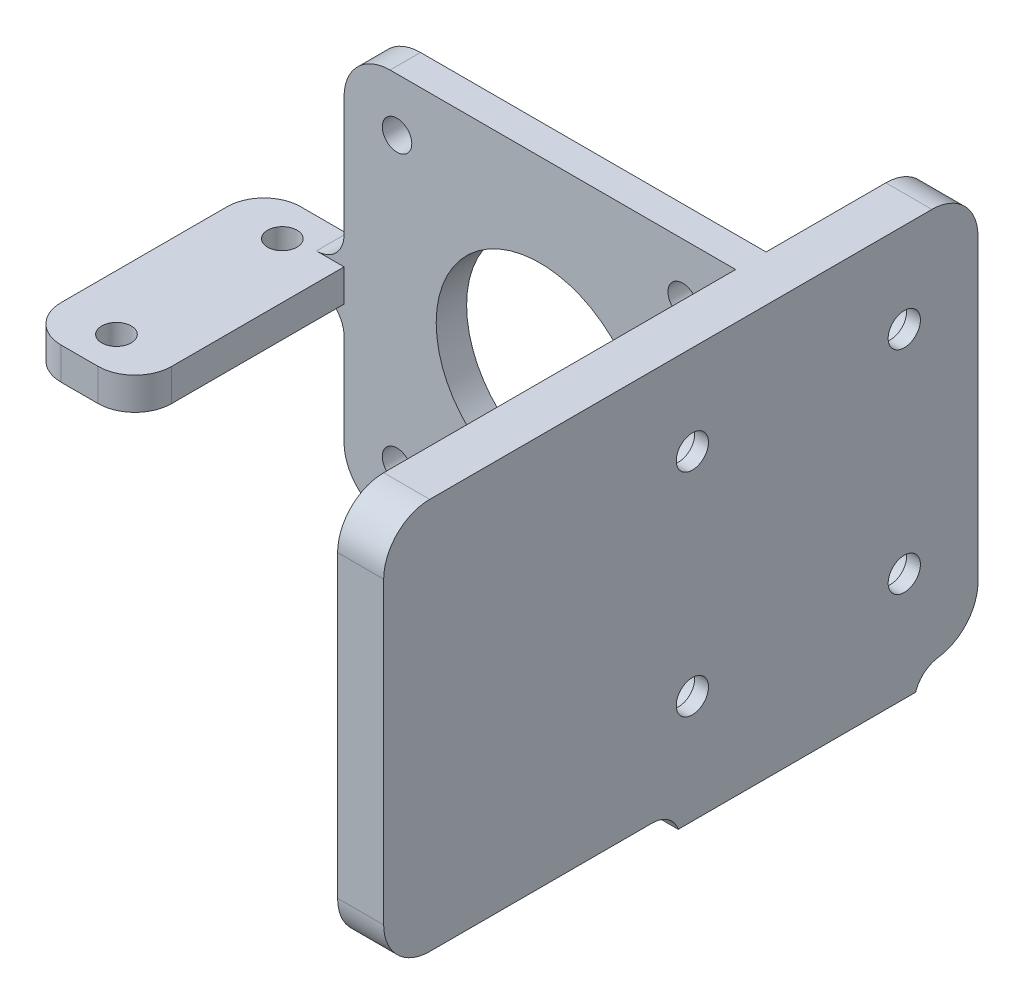
from build123d import *

# Parameters (mm, degrees)
CROQUIS1_W               = 42.5
CROQUIS1_H               = 42.5
SALIENTE_EXTRUIR1_DEPTH  = 5
CROQUIS6_W               = 5
CROQUIS6_H               = 42.5
SALIENTE_EXTRUIR2_DEPTH  = 4
CROQUIS7_W               = 4
CROQUIS7_H               = 42.5
SALIENTE_EXTRUIR3_DEPTH  = 42.5
CROQUIS8_R               = 11.25
CROQUIS8_R_2             = 1.6
CORTAR_EXTRUIR2_DEPTH    = 4
CROQUIS10_W              = 4
CROQUIS10_H              = 3.5
SALIENTE_EXTRUIR4_DEPTH  = 12
CROQUIS11_W              = 12
CROQUIS11_H              = 3.5
SALIENTE_EXTRUIR5_DEPTH  = 22
CROQUIS12_R              = 1.6
CORTAR_EXTRUIR4_DEPTH    = 3.5
REDONDEO1_R              = 5
REDONDEO2_R              = 5
REDONDEO3_R              = 4
CORTAR_EXTRUIR5_DEPTH    = 0.7
CROQUIS14_W              = 5
CROQUIS14_H              = 42.5
SALIENTE_EXTRUIR6_DEPTH  = 18
CROQUIS15_R              = 1.75
CORTAR_EXTRUIR6_DEPTH    = 5
CROQUIS16_R              = 2.8
CORTAR_EXTRUIR7_DEPTH    = 3.5
CROQUIS17_R              = 2.8
CORTAR_EXTRUIR8_DEPTH    = 3.5
REDONDEO5_R              = 5
CROQUIS18_R              = 1.6
SALIENTE_EXTRUIR8_DEPTH  = 2
CROQUIS19_R              = 1.6
CORTAR_EXTRUIR9_DEPTH    = 2
REDONDEO7_R              = 3
REDONDEO8_R              = 3
SALIENTE_EXTRUIR9_DEPTH  = 2
SALIENTE_EXTRUIR10_DEPTH = 2
CROQUIS22_W              = 26.97020456
CROQUIS22_H              = 2
CORTAR_EXTRUIR10_DEPTH   = 5
CROQUIS23_W              = 1.770204561
CROQUIS23_H              = 2
CORTAR_EXTRUIR11_DEPTH   = 5
REDONDEO9_R              = 3


with BuildPart() as part:
    # Croquis1 → Saliente-Extruir1 (new body)
    with BuildSketch(Plane(origin=(0, 0, 0), x_dir=(0, 0, -1), z_dir=(1, 0, 0))):
        with Locations((-2.329734219, -7.130398671)):
            Rectangle(CROQUIS1_W, CROQUIS1_H)
    extrude(amount=-SALIENTE_EXTRUIR1_DEPTH)

    # Croquis6 → Saliente-Extruir2 (add)
    with BuildSketch(Plane(origin=(0, 0, -18.920265781), x_dir=(-1, 0, 0), z_dir=(0, 0, -1))):
        with Locations((2.5, -7.130398671)):
            Rectangle(CROQUIS6_W, CROQUIS6_H)
    extrude(amount=SALIENTE_EXTRUIR2_DEPTH)

    # Croquis7 → Saliente-Extruir3 (add)
    with BuildSketch(Plane.ZY.offset(5)):
        with Locations((-20.920265781, -7.130398671)):
            Rectangle(CROQUIS7_W, CROQUIS7_H)
    extrude(amount=SALIENTE_EXTRUIR3_DEPTH)

    # Croquis8 → Cortar-Extruir2 (cut)
    with BuildSketch(Plane.XY.offset(-18.920265781)):
        with Locations((-26.25, -7.130398671)):
            Circle(CROQUIS8_R)
        with Locations((-41.75, 8.369601329)):
            Circle(CROQUIS8_R_2)
        with Locations((-10.75, 8.369601329)):
            Circle(CROQUIS8_R_2)
        with Locations((-10.75, -22.630398671)):
            Circle(CROQUIS8_R_2)
        with Locations((-41.75, -22.630398671)):
            Circle(CROQUIS8_R_2)
    extrude(amount=-CORTAR_EXTRUIR2_DEPTH, mode=Mode.SUBTRACT)

    # Croquis10 → Saliente-Extruir4 (add)
    with BuildSketch(Plane.ZY.offset(47.5)):
        with Locations((-20.920265781, -6.630398671)):
            Rectangle(CROQUIS10_W, CROQUIS10_H)
    extrude(amount=SALIENTE_EXTRUIR4_DEPTH)

    # Croquis11 → Saliente-Extruir5 (add)
    with BuildSketch(Plane.XY.offset(-18.920265781)):
        with Locations((-53.5, -6.630398671)):
            Rectangle(CROQUIS11_W, CROQUIS11_H)
    extrude(amount=SALIENTE_EXTRUIR5_DEPTH)

    # Croquis12 → Cortar-Extruir4 (cut)
    with BuildSketch(Plane(origin=(0, -4.880398671, 0), x_dir=(1, 0, 0), z_dir=(0, 1, 0))):
        with Locations(Location((-53.5, 18.920265781, 0), (0, 0, 270))):
            Circle(CROQUIS12_R)
        with Locations(Location((-53.5, 0.920265781, 0), (0, 0, 270))):
            Circle(CROQUIS12_R)
    extrude(amount=-CORTAR_EXTRUIR4_DEPTH, mode=Mode.SUBTRACT)

    # Redondeo1
    redondeo1_edges = [part.edges().sort_by_distance(p)[0] for p in [
        (-2.5, -28.380398671, 23.579734219),
        (-2.5, 14.119601329, 23.579734219),
    ]]
    fillet(redondeo1_edges, radius=REDONDEO1_R)

    # Redondeo2
    redondeo2_edges = [part.edges().sort_by_distance(p)[0] for p in [
        (-47.5, -28.380398671, -20.920265781),
        (-47.5, 14.119601329, -20.920265781),
    ]]
    fillet(redondeo2_edges, radius=REDONDEO2_R)

    # Redondeo3
    redondeo3_edges = [part.edges().sort_by_distance(p)[0] for p in [
        (-59.5, -6.630398671, -22.920265781),
        (-59.5, -6.630398671, 3.079734219),
        (-47.5, -6.630398671, 3.079734219),
    ]]
    fillet(redondeo3_edges, radius=REDONDEO3_R)

    # Croquis13 → Cortar-Extruir5 (cut)
    with BuildSketch(Plane.XY.offset(-18.920265781)):
        with BuildLine():
            Line((-47.5, -8.380398671), (-47.5, -23.380398671))
            ThreePointArc((-47.5, -23.380398671), (-46.035533906, -26.915932577), (-42.5, -28.380398671))
            Line((-42.5, -28.380398671), (-5, -28.380398671))
            Line((-5, -28.380398671), (-5, 14.119601329))
            Line((-5, 14.119601329), (-42.5, 14.119601329))
            ThreePointArc((-42.5, 14.119601329), (-46.035533906, 12.655135235), (-47.5, 9.119601329))
            Line((-47.5, 9.119601329), (-47.5, -4.880398671))
            Line((-47.5, -4.880398671), (-47.5, -8.380398671))
        make_face()
    extrude(amount=-CORTAR_EXTRUIR5_DEPTH, mode=Mode.SUBTRACT)

    # Croquis14 → Saliente-Extruir6 (add)
    with BuildSketch(Plane(origin=(0, 0, -22.920265781), x_dir=(-1, 0, 0), z_dir=(0, 0, -1))):
        with Locations((2.5, -7.130398671)):
            Rectangle(CROQUIS14_W, CROQUIS14_H)
    extrude(amount=SALIENTE_EXTRUIR6_DEPTH)

    # Croquis15 → Cortar-Extruir6 (cut)
    with BuildSketch(Plane(origin=(0, 0, 0), x_dir=(0, 0, -1), z_dir=(1, 0, 0))):
        with Locations((9.920265781, 4.369601329)):
            Circle(CROQUIS15_R)
        with Locations((32.920265781, 4.369601329)):
            Circle(CROQUIS15_R)
        with Locations((32.920265781, -18.630398671)):
            Circle(CROQUIS15_R)
        with Locations((9.920265781, -18.630398671)):
            Circle(CROQUIS15_R)
    extrude(amount=-CORTAR_EXTRUIR6_DEPTH, mode=Mode.SUBTRACT)

    # Croquis16 → Cortar-Extruir7 (cut)
    with BuildSketch(Plane.ZY.offset(5)):
        with Locations((-9.920265781, 4.369601329)):
            Circle(CROQUIS16_R)
        with Locations((-9.920265781, -18.630398671)):
            Circle(CROQUIS16_R)
    extrude(amount=-CORTAR_EXTRUIR7_DEPTH, mode=Mode.SUBTRACT)

    # Croquis17 → Cortar-Extruir8 (cut)
    with BuildSketch(Plane.ZY.offset(5)):
        with Locations(Location((-32.920265781, 4.369601329, 0), (0, 0, 270))):
            Circle(CROQUIS17_R)
        with Locations(Location((-32.920265781, -18.630398671, 0), (0, 0, 270))):
            Circle(CROQUIS17_R)
    extrude(amount=-CORTAR_EXTRUIR8_DEPTH, mode=Mode.SUBTRACT)

    # Redondeo5
    redondeo5_edges = [part.edges().sort_by_distance(p)[0] for p in [
        (-2.5, -28.380398671, -40.920265781),
        (-2.5, 14.119601329, -40.920265781),
    ]]
    fillet(redondeo5_edges, radius=REDONDEO5_R)

    # Croquis18 → Saliente-Extruir8 (add)
    with BuildSketch(Plane.XZ.offset(8.380398671)):
        with BuildLine():
            Line((-59.5, -0.920265781), (-59.5, -18.920265781))
            ThreePointArc((-59.5, -18.920265781), (-58.328427125, -21.748692905), (-55.5, -22.920265781))
            Line((-55.5, -22.920265781), (-47.5, -22.920265781))
            Line((-47.5, -22.920265781), (-47.5, -19.620265781))
            Line((-47.5, -19.620265781), (-47.5, -0.920265781))
            ThreePointArc((-47.5, -0.920265781), (-48.671572875, 1.908161344), (-51.5, 3.079734219))
            Line((-51.5, 3.079734219), (-55.5, 3.079734219))
            ThreePointArc((-55.5, 3.079734219), (-58.328427125, 1.908161344), (-59.5, -0.920265781))
        make_face()
        with Locations(Location((-53.5, -0.920265781, 0), (0, 0, 90))):
            Circle(CROQUIS18_R, mode=Mode.SUBTRACT)
        with Locations(Location((-53.5, -18.920265781, 0), (0, 0, 90))):
            Circle(CROQUIS18_R, mode=Mode.SUBTRACT)
    extrude(amount=SALIENTE_EXTRUIR8_DEPTH)

    # Croquis19 → Cortar-Extruir9 (cut)
    with BuildSketch(Plane(origin=(0, -4.880398671, 0), x_dir=(1, 0, 0), z_dir=(0, 1, 0))):
        with BuildLine():
            Line((-51.5, -3.079734219), (-55.5, -3.079734219))
            ThreePointArc((-55.5, -3.079734219), (-58.328427125, -1.908161344), (-59.5, 0.920265781))
            Line((-59.5, 0.920265781), (-59.5, 18.920265781))
            ThreePointArc((-59.5, 18.920265781), (-58.328427125, 21.748692905), (-55.5, 22.920265781))
            Line((-55.5, 22.920265781), (-47.5, 22.920265781))
            Line((-47.5, 22.920265781), (-47.5, 19.620265781))
            Line((-47.5, 19.620265781), (-47.5, 0.920265781))
            ThreePointArc((-47.5, 0.920265781), (-48.671572875, -1.908161344), (-51.5, -3.079734219))
        make_face()
        with Locations(Location((-53.5, 18.920265781, 0), (0, 0, 270))):
            Circle(CROQUIS19_R, mode=Mode.SUBTRACT)
        with Locations(Location((-53.5, 0.920265781, 0), (0, 0, 270))):
            Circle(CROQUIS19_R, mode=Mode.SUBTRACT)
    extrude(amount=-CORTAR_EXTRUIR9_DEPTH, mode=Mode.SUBTRACT)

    # Redondeo7
    redondeo7_edges = [part.edges().sort_by_distance(p)[0] for p in [
        (-47.5, -6.880398671, -21.270265781),
    ]]
    fillet(redondeo7_edges, radius=REDONDEO7_R)

    # Redondeo8
    redondeo8_edges = [part.edges().sort_by_distance(p)[0] for p in [
        (-47.5, -10.380398671, -21.270265781),
    ]]
    fillet(redondeo8_edges, radius=REDONDEO8_R)

    # Croquis20 → Saliente-Extruir9 (add)
    with BuildSketch(Plane.XZ.offset(28.380398671)):
        Polygon((-5, -22.920265781), (-5, -35.920265781), (0, -35.920265781), (0, 18.579734219), (-5, 18.579734219), (-5, -19.620265781), (-42.5, -19.620265781), (-42.5, -22.920265781), align=None)
    extrude(amount=SALIENTE_EXTRUIR9_DEPTH)

    # Croquis21 → Saliente-Extruir10 (add)
    with BuildSketch(Plane.XZ.offset(30.380398671)):
        with BuildLine():
            Line((-16.22979544, -19.620265781), (-5, -19.620265781))
            Line((-5, -19.620265781), (-5, -8.390470341))
            ThreePointArc((-5, -8.390470341), (-8.771291942, -15.848973839), (-16.22979544, -19.620265781))
        make_face()
        with BuildLine():
            ThreePointArc((-16.22979544, -22.920265781), (-8.525539397, -26.445805177), (-5, -34.15006122))
            Line((-5, -34.15006122), (-5, -22.920265781))
            Line((-5, -22.920265781), (-16.22979544, -22.920265781))
        make_face()
    extrude(amount=-SALIENTE_EXTRUIR10_DEPTH)

    # Croquis22 → Cortar-Extruir10 (cut)
    with BuildSketch(Plane.ZY.offset(5)):
        with Locations((5.094631939, -29.380398671)):
            Rectangle(CROQUIS22_W, CROQUIS22_H)
    extrude(amount=-CORTAR_EXTRUIR10_DEPTH, mode=Mode.SUBTRACT)

    # Croquis23 → Cortar-Extruir11 (cut)
    with BuildSketch(Plane.ZY.offset(5)):
        with Locations((-35.035163501, -29.380398671)):
            Rectangle(CROQUIS23_W, CROQUIS23_H)
    extrude(amount=-CORTAR_EXTRUIR11_DEPTH, mode=Mode.SUBTRACT)

    # Redondeo9
    # the kernel refuses this fillet: 3 mm, written as the material it adds along each edge
    with BuildSketch(Plane(origin=(-5, -28.380398671, -34.15006122), x_dir=(0, -1, 0), z_dir=(1, 0, 0))) as redondeo9_piece_1:
        with BuildLine():
            CenterArc((2.926328174, 2.853404303), REDONDEO9_R, 187.781748717, 64.232765745)
            Line((-0.046044891, 2.447204399), (-0.343282198, 2.406584409))
            ThreePointArc((-0.343282198, 2.406584409), (-0.3, 1.77020456), (-0.3, 0))
            Line((-0.3, 0), (0, -0.3))
            ThreePointArc((0, -0.3), (1, -0.3), (1.907367183, -0.28534043))
            Line((1.907367183, -0.28534043), (2, 0))
        make_face()
    extrude(amount=5)
    with BuildSketch(Plane(origin=(-5, -28.380398671, -8.390470341), x_dir=(0, -1, 0), z_dir=(1, 0, 0))) as redondeo9_piece_2:
        with BuildLine():
            CenterArc((3, -2.828427125), REDONDEO9_R, 109.471220634, 70.528779366)
            Line((0, -2.828427125), (0, 0))
            Line((0, 0), (2, 0))
        make_face()
    extrude(amount=5)


solid = part.part
